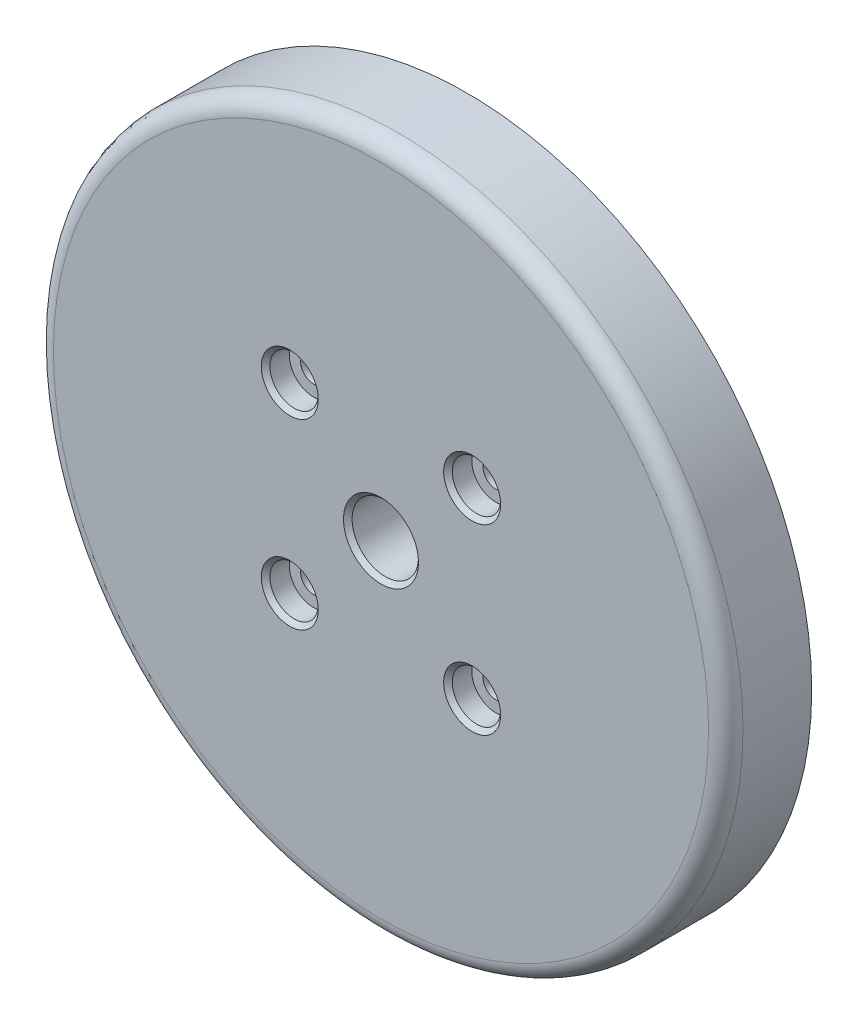
from build123d import *

# Parameters (mm, degrees)
SKETCH1_R                                     = 50.927
BOSS_EXTRUDE1_DEPTH                           = 12.7
W_0_386_DIAMETER_HOLE1_D                      = 9.8044
W_0_386_DIAMETER_HOLE1_CSINK_D                = 11.0744
W_0_386_DIAMETER_HOLE1_CSINK_ANGLE            = 90
CBORE_FOR_6_SOCKET_HEAD_CAP_SCREW1_AT_2_COUNT = 2
CBORE_FOR_6_SOCKET_HEAD_CAP_SCREW1_AT_2_PITCH = 38.1
CBORE_FOR_6_SOCKET_HEAD_CAP_SCREW1_AT_3_COUNT = 2
CBORE_FOR_6_SOCKET_HEAD_CAP_SCREW1_AT_3_PITCH = 26.940768363
CBORE_FOR_6_SOCKET_HEAD_CAP_SCREW1_AT_4_COUNT = 2
CBORE_FOR_6_SOCKET_HEAD_CAP_SCREW1_AT_4_PITCH = 26.940768363
FILLET1_R                                     = 2.54
SKETCH7_R                                     = 15.9385
SKETCH7_R_2                                   = 12.446
CUT_EXTRUDE2_DEPTH                            = 6.35
SKETCH6_R                                     = 38.1
CUT_EXTRUDE1_DEPTH                            = 4.826


with BuildPart() as part:
    # Sketch1 → Boss-Extrude1 (new body)
    with BuildSketch(Plane.XY):
        Circle(SKETCH1_R)
    extrude(amount=BOSS_EXTRUDE1_DEPTH)

    # W (0.386) Diameter Hole1 (through all)
    with Locations(Plane.XY.offset(12.7)):
        with Locations((0, 0)):
            CounterSinkHole(W_0_386_DIAMETER_HOLE1_D / 2, W_0_386_DIAMETER_HOLE1_CSINK_D / 2, counter_sink_angle=W_0_386_DIAMETER_HOLE1_CSINK_ANGLE)

    # Sketch5 → CBORE for #6 Socket Head Cap Screw1 (revolve, cut)
    with BuildSketch(Plane(origin=(13.470384182, 13.470384182, 12.7), x_dir=(0, -1, 0), z_dir=(1, 0, 0))):
        Polygon((0, 0), (0, 12.7), (1.89865, 12.7), (1.89865, 3.5052), (3.57251, 3.5052), (3.57251, 0.635), (4.20751, 0), align=None)
    cbore_for_6_socket_head_cap_screw1 = revolve(axis=Axis((13.470384182, 13.470384182, 19.05), (0, 0, -1)), mode=Mode.SUBTRACT)

    # CBORE for #6 Socket Head Cap Screw1 at 2: CBORE for #6 Socket Head Cap Screw1 ×2
    with Locations(*[Vector(-0.7071067811865476, -0.7071067811865476, 0) * (i * CBORE_FOR_6_SOCKET_HEAD_CAP_SCREW1_AT_2_PITCH) for i in range(1, CBORE_FOR_6_SOCKET_HEAD_CAP_SCREW1_AT_2_COUNT)]):
        add(cbore_for_6_socket_head_cap_screw1, mode=Mode.SUBTRACT)

    # CBORE for #6 Socket Head Cap Screw1 at 3: CBORE for #6 Socket Head Cap Screw1 ×2
    with Locations(*[(-i * CBORE_FOR_6_SOCKET_HEAD_CAP_SCREW1_AT_3_PITCH, 0, 0) for i in range(1, CBORE_FOR_6_SOCKET_HEAD_CAP_SCREW1_AT_3_COUNT)]):
        add(cbore_for_6_socket_head_cap_screw1, mode=Mode.SUBTRACT)

    # CBORE for #6 Socket Head Cap Screw1 at 4: CBORE for #6 Socket Head Cap Screw1 ×2
    with Locations(*[(0, -i * CBORE_FOR_6_SOCKET_HEAD_CAP_SCREW1_AT_4_PITCH, 0) for i in range(1, CBORE_FOR_6_SOCKET_HEAD_CAP_SCREW1_AT_4_COUNT)]):
        add(cbore_for_6_socket_head_cap_screw1, mode=Mode.SUBTRACT)

    # Fillet1
    fillet1_edges = [part.edges().sort_by_distance(p)[0] for p in [
        (-50.927, 0, 12.7),
    ]]
    fillet(fillet1_edges, radius=FILLET1_R)

    # Sketch7 → Cut-Extrude2 (cut)
    with BuildSketch(Plane(origin=(0, 0, 0), x_dir=(-1, 0, 0), z_dir=(0, 0, -1))):
        Circle(SKETCH7_R)
        Circle(SKETCH7_R_2, mode=Mode.SUBTRACT)
    extrude(amount=-CUT_EXTRUDE2_DEPTH, mode=Mode.SUBTRACT)

    # Sketch6 → Cut-Extrude1 (cut)
    with BuildSketch(Plane(origin=(0, 0, 0), x_dir=(-1, 0, 0), z_dir=(0, 0, -1))):
        Circle(SKETCH6_R)
    extrude(amount=-CUT_EXTRUDE1_DEPTH, mode=Mode.SUBTRACT)


solid = part.part
